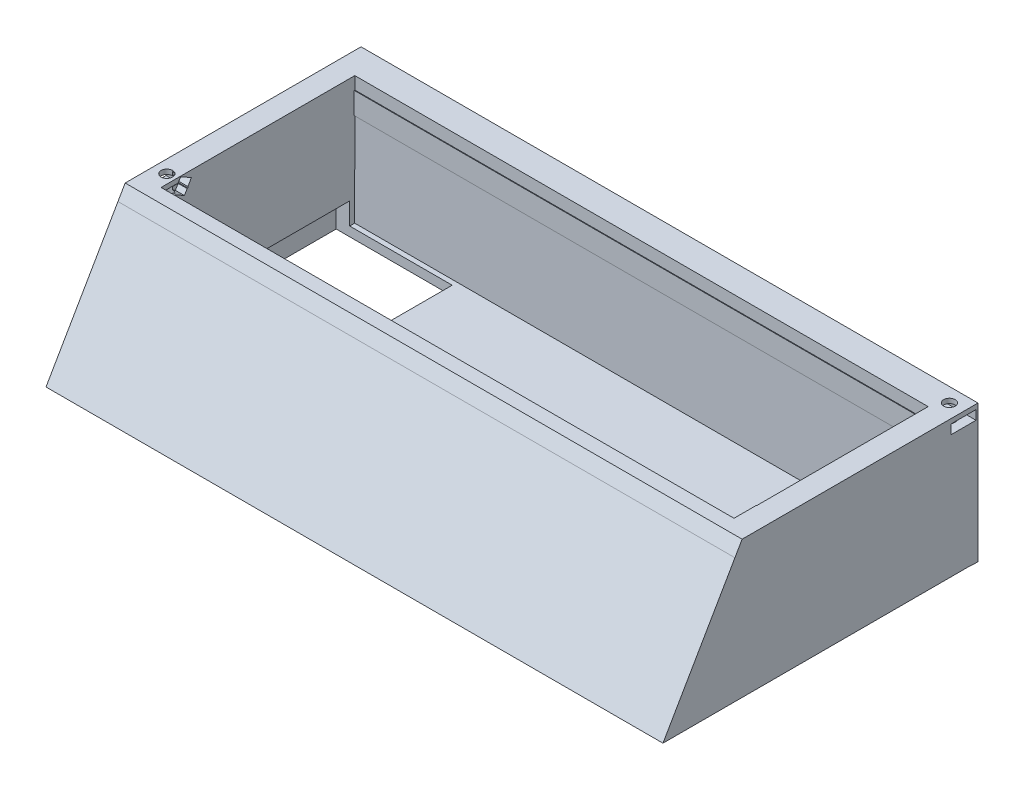
from build123d import *

# Parameters (mm, degrees)
BOSS_EXTRUDE1_DEPTH = 198
SHELL1_T            = -7
BOSS_EXTRUDE2_DEPTH = 191
SKETCH6_W           = 198
SKETCH6_H           = 40.103607498
BOSS_EXTRUDE4_DEPTH = 2
BOSS_EXTRUDE6_DEPTH = 198
SKETCH9_W           = 184
SKETCH9_H           = 55.057025978
CUT_EXTRUDE1_DEPTH  = 4
SKETCH10_W          = 191
SKETCH10_H          = 4.455271989
CUT_EXTRUDE2_DEPTH  = 4
SKETCH11_R          = 1.845894191
SKETCH11_R_2        = 1.836487246
CUT_EXTRUDE3_DEPTH  = 10
CUT_EXTRUDE4_DEPTH  = 10
CUT_EXTRUDE6_DEPTH  = 10
SKETCH16_W          = 183.884244201
SKETCH16_H          = 61.980598042
CUT_EXTRUDE7_DEPTH  = 15
SKETCH17_W          = 90.288181628
SKETCH17_H          = 3
BOSS_EXTRUDE7_DEPTH = 184
SKETCH18_R          = 1.585
SKETCH18_R_2        = 1.63212157
CUT_EXTRUDE8_DEPTH  = 10
SKETCH19_W          = 37.227708601
SKETCH19_H          = 62.195722112
CUT_EXTRUDE9_DEPTH  = 10


with BuildPart() as part:
    # Sketch1 → Boss-Extrude1 (new body)
    with BuildSketch(Plane(origin=(0, 0, 0), x_dir=(0, 0, -1), z_dir=(1, 0, 0))):
        Polygon((22.10846405, 0), (32.441807929, 17.899216821), (45.200737204, 39.99998538), (121.214199537, 39.99998538), (121.18, 0), align=None)
    extrude(amount=BOSS_EXTRUDE1_DEPTH)

    # Shell1
    shell1_openings = [part.faces().sort_by_distance(p)[0] for p in [
        (99, 0, -71.644232025),
    ]]
    offset(amount=SHELL1_T, openings=shell1_openings, kind=Kind.INTERSECTION)

    # Sketch2 → Boss-Extrude2 (add)
    with BuildSketch(Plane.ZY):
        Polygon((-30.191216521, 0), (-32.974854852, 0), (-52.025978727, 32.99998538), (-49.242340395, 32.99998538), align=None)
    extrude(amount=-BOSS_EXTRUDE2_DEPTH)

    # Sketch6 → Boss-Extrude4 (add)
    with BuildSketch(Plane(origin=(0, -0.10360746, -121.179911417), x_dir=(-1, 0, 0), z_dir=(0, -0.0008549884286730706, -0.9999996344973268))):
        with Locations((-99, 20.051803749)):
            Rectangle(SKETCH6_W, SKETCH6_H)
    extrude(amount=BOSS_EXTRUDE4_DEPTH)

    # Sketch8 → Boss-Extrude6 (add)
    with BuildSketch(Plane(origin=(198, 0, 0), x_dir=(0, 0, -1), z_dir=(1, 0, 0))):
        Polygon((123.214198806, 39.998275403), (123.214198806, 52.048275403), (52.157172812, 52.048275403), (45.200737204, 39.99998538), align=None)
    extrude(amount=-BOSS_EXTRUDE6_DEPTH)

    # Sketch9 → Cut-Extrude1 (cut)
    with BuildSketch(Plane(origin=(0, 40.000976116, -0.000876781), x_dir=(-1, 0, 0), z_dir=(0, -0.9999999997597789, 2.1918997334542923e-05))):
        with Locations((-99, 86.684544942)):
            Rectangle(SKETCH9_W, SKETCH9_H)
    extrude(amount=-CUT_EXTRUDE1_DEPTH, mode=Mode.SUBTRACT)

    # Sketch10 → Cut-Extrude2 (cut)
    with BuildSketch(Plane(origin=(0, -14.277996398, -24.732067017), x_dir=(-1, 0, 0), z_dir=(0, -0.49997192092444726, -0.8660416146393418))):
        with Locations((-99.604983797, 64.901002589)):
            Rectangle(SKETCH10_W, SKETCH10_H)
    extrude(amount=CUT_EXTRUDE2_DEPTH, mode=Mode.SUBTRACT)

    # Split4
    split(bisect_by=Plane(origin=(0, 44.000976115, -0.000964457), x_dir=(0, -2.191899733451847e-05, -0.9999999997597789), z_dir=(0, -0.9999999997597789, 2.191899733451847e-05)), keep=Keep.TOP)

    # Sketch11 → Cut-Extrude3 (cut)
    with BuildSketch(Plane(origin=(0, 44.000976115, -0.000964457), x_dir=(1, 0, 0), z_dir=(0, 0.9999999997597789, -2.1918997334518478e-05))):
        with Locations((4.122596141, 56.77218114)):
            Circle(SKETCH11_R)
        with Locations((193.378205815, 118.659575565)):
            Circle(SKETCH11_R_2)
    extrude(amount=-CUT_EXTRUDE3_DEPTH, mode=Mode.SUBTRACT)

    # Sketch13 → Cut-Extrude4 (cut)
    with BuildSketch(Plane.ZY):
        Polygon((-60.651506114, 42.499646715), (-52.651506116, 42.499822067), (-52.651506116, 39.499822067), (-60.651506114, 39.499646715), align=None)
    extrude(amount=-CUT_EXTRUDE4_DEPTH, mode=Mode.SUBTRACT)

    # Sketch15 → Cut-Extrude6 (cut)
    with BuildSketch(Plane(origin=(198, 0, 0), x_dir=(0, 0, -1), z_dir=(1, 0, 0))):
        Polygon((122.578470723, 42.498289338), (114.578470723, 42.49846469), (114.578470723, 39.515348921), (122.578470723, 39.515348921), align=None)
    extrude(amount=-CUT_EXTRUDE6_DEPTH, mode=Mode.SUBTRACT)

    # Sketch16 → Cut-Extrude7 (cut)
    with BuildSketch(Plane(origin=(0, 32.99998538, 0), x_dir=(-1, 0, 0), z_dir=(0, -1, 0))):
        with Locations((-98.942122101, 83.016277748)):
            Rectangle(SKETCH16_W, SKETCH16_H)
    extrude(amount=-CUT_EXTRUDE7_DEPTH, mode=Mode.SUBTRACT)

    # Sketch17 → Boss-Extrude7 (add)
    with BuildSketch(Plane.ZY.offset(-191)):
        with Locations((-73.246099444, 1.5)):
            Rectangle(SKETCH17_W, SKETCH17_H)
    extrude(amount=BOSS_EXTRUDE7_DEPTH)

    # Sketch18 → Cut-Extrude8 (cut)
    with BuildSketch(Plane.XZ):
        with Locations((186.291996716, -44.859873403)):
            Circle(SKETCH18_R)
        with Locations((11.705884172, -44.877084512)):
            Circle(SKETCH18_R_2)
    extrude(amount=-CUT_EXTRUDE8_DEPTH, mode=Mode.SUBTRACT)

    # Sketch19 → Cut-Extrude9 (cut)
    with BuildSketch(Plane.XZ):
        with Locations((21.273328451, -81.47744395)):
            Rectangle(SKETCH19_W, SKETCH19_H)
    cut_extrude9 = extrude(amount=-CUT_EXTRUDE9_DEPTH, mode=Mode.SUBTRACT)

    # Mirror1: Cut-Extrude9 across plane
    add(cut_extrude9.mirror(Plane(origin=(99, 0, 0), x_dir=(0, 0, 1), z_dir=(1, 0, 0))), mode=Mode.SUBTRACT)


solid = part.part
